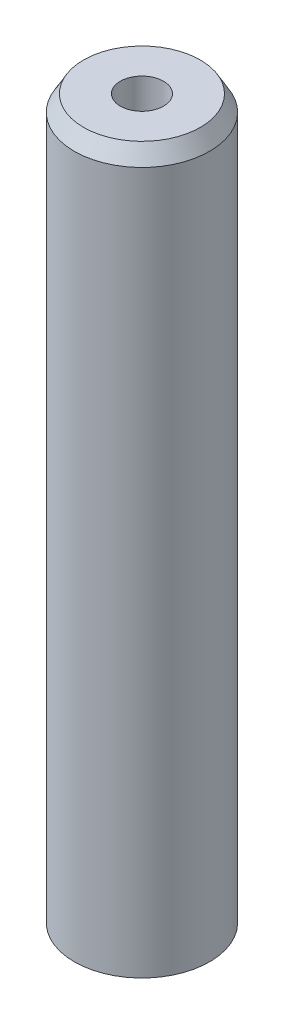
from build123d import *
from OCP.BRepFilletAPI import BRepFilletAPI_MakeChamfer

# Parameters (mm, degrees)
SKETCH1_R           = 20
BOSS_EXTRUDE1_DEPTH = 214.938473768
SKETCH2_R           = 6.386973445
CUT_EXTRUDE1_DEPTH  = 217.791483933
CHAMFER1_SIZE       = 4.750736875
CHAMFER1_SIZE2      = 2.742839214


with BuildPart() as part:
    # Sketch1 → Boss-Extrude1 (new body)
    with BuildSketch(Plane(origin=(0, 0, 0), x_dir=(1, 0, 0), z_dir=(0, 1, 0))):
        Circle(SKETCH1_R)
    extrude(amount=BOSS_EXTRUDE1_DEPTH)

    # Sketch2 → Cut-Extrude1 (cut, through all)
    with BuildSketch(Plane(origin=(0, 0, 0), x_dir=(1, 0, 0), z_dir=(0, 1, 0))):
        Circle(SKETCH2_R)
    extrude(amount=CUT_EXTRUDE1_DEPTH, mode=Mode.SUBTRACT)

    # Chamfer1: one chamfer whose edges measure the first distance from different faces: ONE call of the kernel's chamfer builder (chamfer() names one face for all edges)
    chamfer1_edges_1 = [part.edges().sort_by_distance(p)[0] for p in [
        (-20, 214.938473768, 0),
    ]]
    chamfer1_side_1 = [part.faces().sort_by_distance(p)[0] for p in [
        (-20, 107.469236884, 0),
    ]]
    chamfer1_edges_2 = [part.edges().sort_by_distance(p)[0] for p in [
        (-20, 0, 0),
    ]]
    chamfer1_side_2 = [part.faces().sort_by_distance(p)[0] for p in [
        (-19.434314575, 0, 0),
    ]]
    chamfer1 = BRepFilletAPI_MakeChamfer(part.part.solid().wrapped)
    for e in chamfer1_edges_1:
        chamfer1.Add(CHAMFER1_SIZE, CHAMFER1_SIZE2, e.wrapped, chamfer1_side_1[0].wrapped)  # the first distance lies on this face
    for e in chamfer1_edges_2:
        chamfer1.Add(CHAMFER1_SIZE, CHAMFER1_SIZE2, e.wrapped, chamfer1_side_2[0].wrapped)  # the first distance lies on this face
    add(Compound.cast(chamfer1.Shape()), mode=Mode.REPLACE)


solid = part.part
